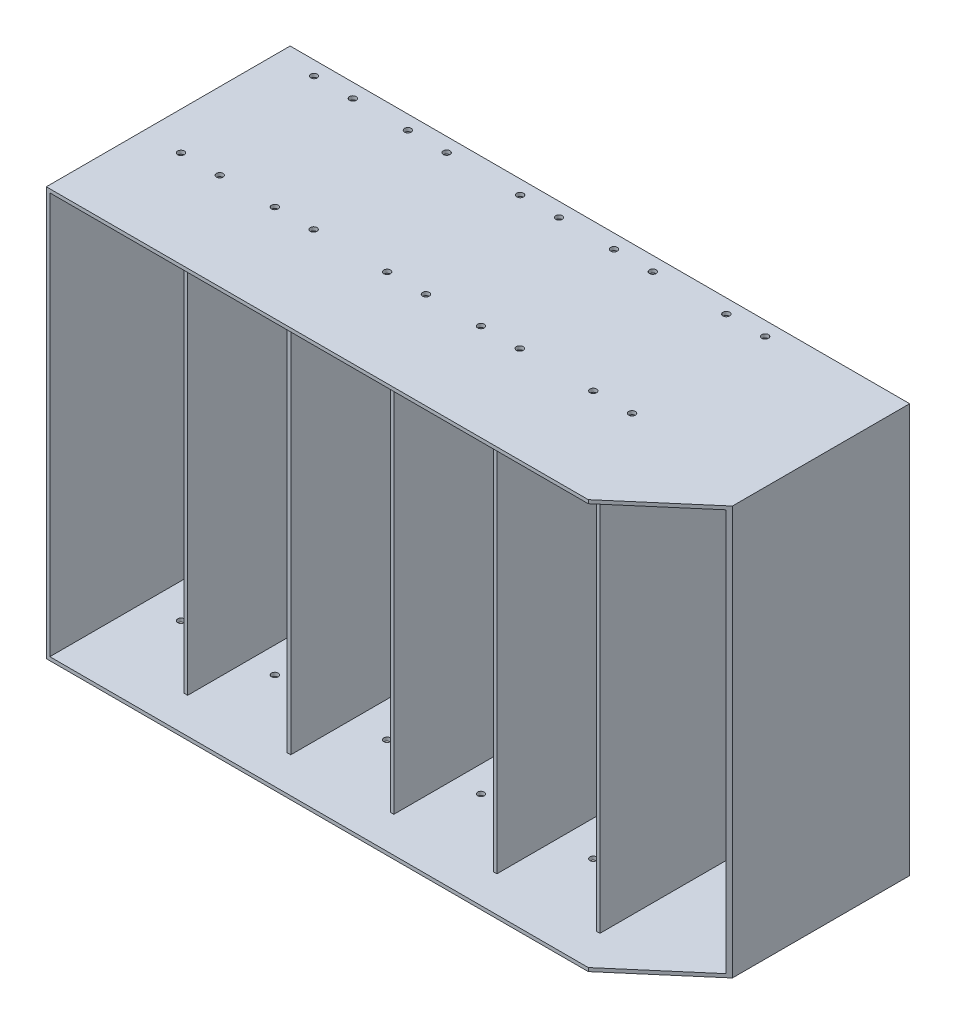
from build123d import *

# Parameters (mm, degrees)
SKETCH1_W           = 558.8
SKETCH1_H           = 368.6625
BOSS_EXTRUDE1_DEPTH = 3.175
SKETCH2_W           = 558.8
SKETCH2_H           = 368.6625
SKETCH2_W_2         = 88.26275
SKETCH2_H_2         = 362.3125
SKETCH2_W_3         = 89.789
SKETCH2_W_4         = 89.15625
BOSS_EXTRUDE2_DEPTH = 184.725
SKETCH3_W           = 558.8
SKETCH3_H           = 368.6625
BOSS_EXTRUDE3_DEPTH = 32
CUT_EXTRUDE1_DEPTH  = 513.183960024
SKETCH5_R           = 3
CUT_EXTRUDE2_DEPTH  = 513.183960024
LPATTERN1_COUNT     = 3
LPATTERN1_PITCH     = 185.928
SKETCH6_R           = 3
CUT_EXTRUDE3_DEPTH  = 513.183960024
LPATTERN2_COUNT     = 2
LPATTERN2_PITCH     = 185.928


with BuildPart() as part:
    # Sketch1 → Boss-Extrude1 (new body)
    with BuildSketch(Plane.XY):
        Rectangle(SKETCH1_W, SKETCH1_H)
    extrude(amount=BOSS_EXTRUDE1_DEPTH)

    # Sketch2 → Boss-Extrude2 (add)
    with BuildSketch(Plane.XY.offset(3.175)):
        Rectangle(SKETCH2_W, SKETCH2_H)
        with Locations((232.093625, 0)):
            Rectangle(SKETCH2_W_2, SKETCH2_H_2, mode=Mode.SUBTRACT)
        with Locations((139.89275, 0)):
            Rectangle(SKETCH2_W_3, SKETCH2_H_2, mode=Mode.SUBTRACT)
        with Locations((46.92875, 0)):
            Rectangle(SKETCH2_W_3, SKETCH2_H_2, mode=Mode.SUBTRACT)
        with Locations((-46.03525, 0)):
            Rectangle(SKETCH2_W_3, SKETCH2_H_2, mode=Mode.SUBTRACT)
        with Locations((-138.99925, 0)):
            Rectangle(SKETCH2_W_3, SKETCH2_H_2, mode=Mode.SUBTRACT)
        with Locations((-231.646875, 0)):
            Rectangle(SKETCH2_W_4, SKETCH2_H_2, mode=Mode.SUBTRACT)
    extrude(amount=BOSS_EXTRUDE2_DEPTH)

    # Sketch3 → Boss-Extrude3 (add)
    with BuildSketch(Plane.XY.offset(187.9)):
        Rectangle(SKETCH3_W, SKETCH3_H)
        Polygon((187.96225, 181.15625), (276.225, 181.15625), (276.225, -181.15625), (187.96225, -181.15625), (184.78725, -181.15625), (94.99825, -181.15625), (91.82325, -181.15625), (2.03425, -181.15625), (-1.14075, -181.15625), (-90.92975, -181.15625), (-94.10475, -181.15625), (-183.89375, -181.15625), (-187.06875, -181.15625), (-276.225, -181.15625), (-276.225, 181.15625), (-187.06875, 181.15625), (-183.89375, 181.15625), (-94.10475, 181.15625), (-90.92975, 181.15625), (-1.14075, 181.15625), (2.03425, 181.15625), (91.82325, 181.15625), (94.99825, 181.15625), (184.78725, 181.15625), align=None, mode=Mode.SUBTRACT)
    extrude(amount=BOSS_EXTRUDE3_DEPTH)

    # Sketch4 → Cut-Extrude1 (cut, through all)
    with BuildSketch(Plane.XZ.offset(184.33125)):
        Polygon((279.4, 219.9), (209.4, 219.9), (279.4, 159.9), align=None)
    extrude(amount=-CUT_EXTRUDE1_DEPTH, mode=Mode.SUBTRACT)

    # Sketch5 → Cut-Extrude2 (cut, through all)
    with BuildSketch(Plane.XZ.offset(184.33125)):
        with Locations((-210.146875, 12.7)):
            Circle(SKETCH5_R)
        with Locations((-245.146875, 12.7)):
            Circle(SKETCH5_R)
        with Locations((-210.146875, 132.7)):
            Circle(SKETCH5_R)
        with Locations((-245.146875, 132.7)):
            Circle(SKETCH5_R)
    cut_extrude2 = extrude(amount=-CUT_EXTRUDE2_DEPTH, mode=Mode.SUBTRACT)

    # LPattern1: Cut-Extrude2 ×3
    with Locations(*[(i * LPATTERN1_PITCH, 0, 0) for i in range(1, LPATTERN1_COUNT)]):
        add(cut_extrude2, mode=Mode.SUBTRACT)

    # Sketch6 → Cut-Extrude3 (cut, through all)
    with BuildSketch(Plane.XZ.offset(184.33125)):
        with Locations((-125.49925, 132.7)):
            Circle(SKETCH6_R)
        with Locations((-160.49925, 132.7)):
            Circle(SKETCH6_R)
        with Locations((-125.49925, 12.7)):
            Circle(SKETCH6_R)
        with Locations((-160.49925, 12.7)):
            Circle(SKETCH6_R)
    cut_extrude3 = extrude(amount=-CUT_EXTRUDE3_DEPTH, mode=Mode.SUBTRACT)

    # LPattern2: Cut-Extrude3 ×2
    with Locations(*[(i * LPATTERN2_PITCH, 0, 0) for i in range(1, LPATTERN2_COUNT)]):
        add(cut_extrude3, mode=Mode.SUBTRACT)


solid = part.part
